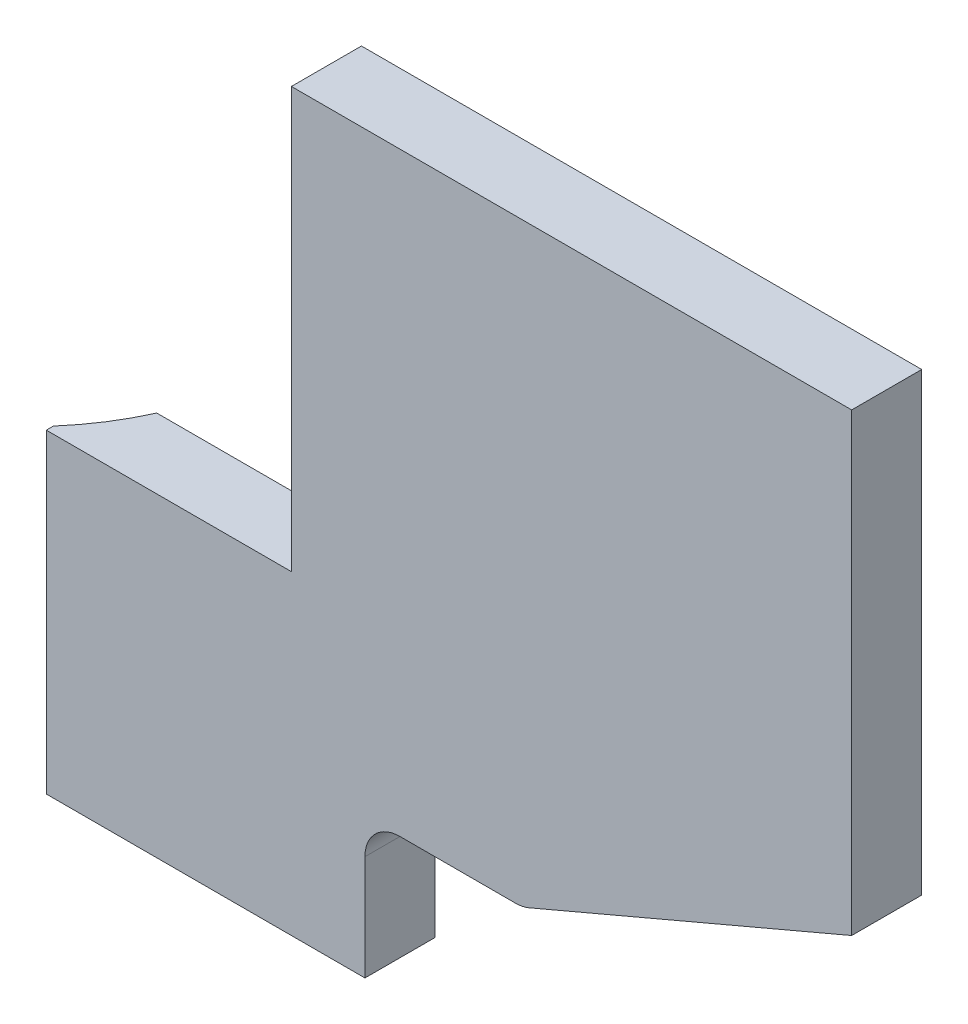
from build123d import *

# Parameters (mm, degrees)
SKETCH1_W           = 80
SKETCH1_H           = 65
BOSS_EXTRUDE1_DEPTH = 10
SKETCH3_W           = 80
SKETCH3_H           = 10
BOSS_EXTRUDE2_DEPTH = 40
SKETCH4_W           = 10
SKETCH4_H           = 45
BOSS_EXTRUDE3_DEPTH = 35
SKETCH5_R           = 36.5
CUT_EXTRUDE2_DEPTH  = 97.566039579
CUT_EXTRUDE3_DEPTH  = 105.791459576


with BuildPart() as part:
    # Sketch1 → Boss-Extrude1 (new body)
    with BuildSketch(Plane.XY):
        Rectangle(SKETCH1_W, SKETCH1_H)
    extrude(amount=BOSS_EXTRUDE1_DEPTH)

    # Sketch3 → Boss-Extrude2 (add)
    with BuildSketch(Plane.XZ.offset(32.5)):
        with Locations((0, 5)):
            Rectangle(SKETCH3_W, SKETCH3_H)
    extrude(amount=BOSS_EXTRUDE2_DEPTH)

    # Sketch4 → Boss-Extrude3 (add)
    with BuildSketch(Plane.ZY.offset(40)):
        with Locations((5, -50)):
            Rectangle(SKETCH4_W, SKETCH4_H)
    extrude(amount=BOSS_EXTRUDE3_DEPTH)

    # Sketch5 → Cut-Extrude2 (cut, through all)
    with BuildSketch(Plane(origin=(0, -27.5, 0), x_dir=(1, 0, 0), z_dir=(0, 1, 0))):
        with Locations((-102.5, 15)):
            Circle(SKETCH5_R)
    extrude(amount=-CUT_EXTRUDE2_DEPTH, mode=Mode.SUBTRACT)

    # Sketch6 → Cut-Extrude3 (cut, through all)
    with BuildSketch(Plane.XY.offset(10)):
        with BuildLine():
            Line((-29.5, -72.5), (40, -72.5))
            Line((40, -72.5), (40, -32.5))
            Line((40, -32.5), (-6.061816969, -52.100773178))
            ThreePointArc((-6.061816969, -52.100773178), (-7.020559729, -52.399176762), (-8.019592789, -52.5))
            Line((-8.019592789, -52.5), (-24.5, -52.5))
            ThreePointArc((-24.5, -52.5), (-28.035533906, -53.964466094), (-29.5, -57.5))
            Line((-29.5, -57.5), (-29.5, -72.5))
        make_face()
    extrude(amount=-CUT_EXTRUDE3_DEPTH, mode=Mode.SUBTRACT)


solid = part.part
